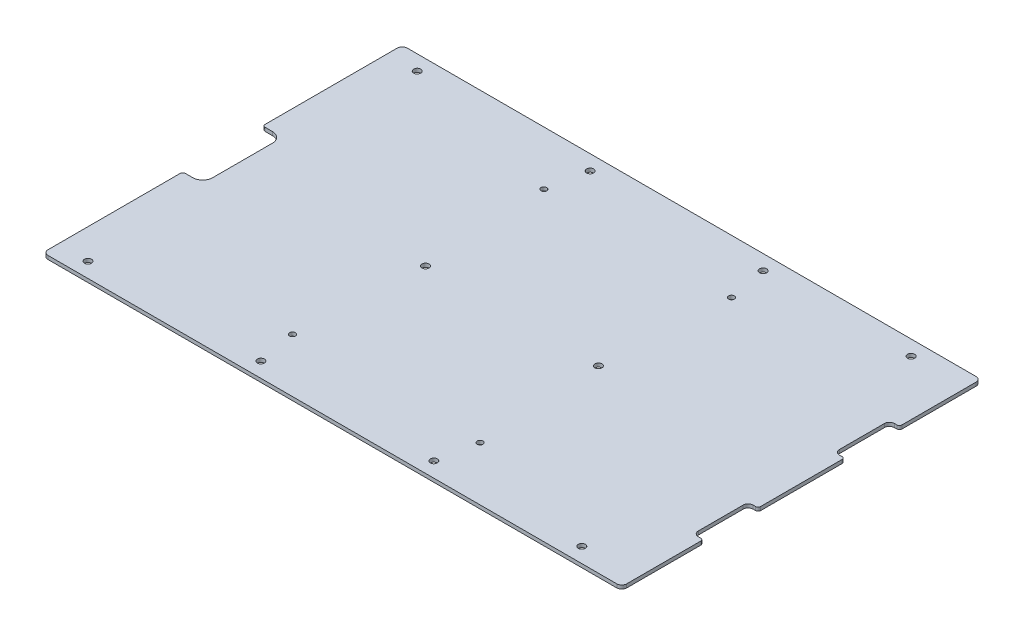
from build123d import *

# Parameters (mm, degrees)
SKETCH1_R           = 2.2479
SKETCH1_R_2         = 1.8288
BOSS_EXTRUDE1_DEPTH = 2.286
CUT_EXTRUDE1_DEPTH  = 217.750866886
FILLET1_R           = 1.5875


with BuildPart() as part:
    # Sketch1 → Boss-Extrude1 (new body)
    with BuildSketch(Plane(origin=(0, 0, 0), x_dir=(1, 0, 0), z_dir=(0, 1, 0))):
        with BuildLine():
            Line((-180.975, 114.3), (180.975, 114.3))
            ThreePointArc((180.975, 114.3), (183.22006403, 113.37006403), (184.15, 111.125))
            Line((184.15, 111.125), (184.15, -111.125))
            ThreePointArc((184.15, -111.125), (183.22006403, -113.37006403), (180.975, -114.3))
            Line((180.975, -114.3), (-180.975, -114.3))
            ThreePointArc((-180.975, -114.3), (-183.22006403, -113.37006403), (-184.15, -111.125))
            Line((-184.15, -111.125), (-184.15, 111.125))
            ThreePointArc((-184.15, 111.125), (-183.22006403, 113.37006403), (-180.975, 114.3))
        make_face()
        with Locations((-165.1, 104.775)):
            Circle(SKETCH1_R, mode=Mode.SUBTRACT)
        with Locations((-55.033333333, 104.775)):
            Circle(SKETCH1_R, mode=Mode.SUBTRACT)
        with Locations((55.033333333, 104.775)):
            Circle(SKETCH1_R, mode=Mode.SUBTRACT)
        with Locations((55.033333333, -104.775)):
            Circle(SKETCH1_R, mode=Mode.SUBTRACT)
        with Locations((-55.033333333, -104.775)):
            Circle(SKETCH1_R, mode=Mode.SUBTRACT)
        with Locations((-165.1, -104.775)):
            Circle(SKETCH1_R, mode=Mode.SUBTRACT)
        with Locations((-55.033333333, 0)):
            Circle(SKETCH1_R, mode=Mode.SUBTRACT)
        with Locations((55.033333333, 0)):
            Circle(SKETCH1_R, mode=Mode.SUBTRACT)
        with Locations((149.225, -104.775)):
            Circle(SKETCH1_R, mode=Mode.SUBTRACT)
        with Locations((149.225, 104.775)):
            Circle(SKETCH1_R, mode=Mode.SUBTRACT)
        with Locations((59.69, -80.01)):
            Circle(SKETCH1_R_2, mode=Mode.SUBTRACT)
        with Locations((-59.69, -80.01)):
            Circle(SKETCH1_R_2, mode=Mode.SUBTRACT)
        with Locations((-59.69, 80.01)):
            Circle(SKETCH1_R_2, mode=Mode.SUBTRACT)
        with Locations((59.69, 80.01)):
            Circle(SKETCH1_R_2, mode=Mode.SUBTRACT)
    extrude(amount=BOSS_EXTRUDE1_DEPTH)

    # Sketch2 → Cut-Extrude1 (cut, through all)
    with BuildSketch(Plane.XZ):
        with BuildLine():
            Line((184.15, 62.4205), (180.975, 62.4205))
            ThreePointArc((180.975, 62.4205), (178.72993597, 61.49056403), (177.8, 59.2455))
            Line((177.8, 59.2455), (177.8, 30.6705))
            ThreePointArc((177.8, 30.6705), (178.72993597, 28.42543597), (180.975, 27.4955))
            Line((180.975, 27.4955), (184.15, 27.4955))
            Line((184.15, 27.4955), (184.15, 62.4205))
        make_face()
        with BuildLine():
            Line((184.15, -27.4955), (180.975, -27.4955))
            ThreePointArc((180.975, -27.4955), (178.72993597, -28.42543597), (177.8, -30.6705))
            Line((177.8, -30.6705), (177.8, -59.2455))
            ThreePointArc((177.8, -59.2455), (178.72993597, -61.49056403), (180.975, -62.4205))
            Line((180.975, -62.4205), (184.15, -62.4205))
            Line((184.15, -62.4205), (184.15, -27.4955))
        make_face()
        with BuildLine():
            Line((-184.15, 25.4), (-177.8, 25.4))
            ThreePointArc((-177.8, 25.4), (-173.309871939, 23.540128061), (-171.45, 19.05))
            Line((-171.45, 19.05), (-171.45, -19.05))
            ThreePointArc((-171.45, -19.05), (-173.309871939, -23.540128061), (-177.8, -25.4))
            Line((-177.8, -25.4), (-184.15, -25.4))
            Line((-184.15, -25.4), (-184.15, 25.4))
        make_face()
    extrude(amount=-CUT_EXTRUDE1_DEPTH, mode=Mode.SUBTRACT)

    # Fillet1
    fillet1_edges = [part.edges().sort_by_distance(p)[0] for p in [
        (184.15, 1.143, -62.4205),
        (184.15, 1.143, -27.4955),
        (184.15, 1.143, 27.4955),
        (184.15, 1.143, 62.4205),
        (-184.15, 1.143, -25.4),
        (-184.15, 1.143, 25.4),
    ]]
    fillet(fillet1_edges, radius=FILLET1_R)


solid = part.part
